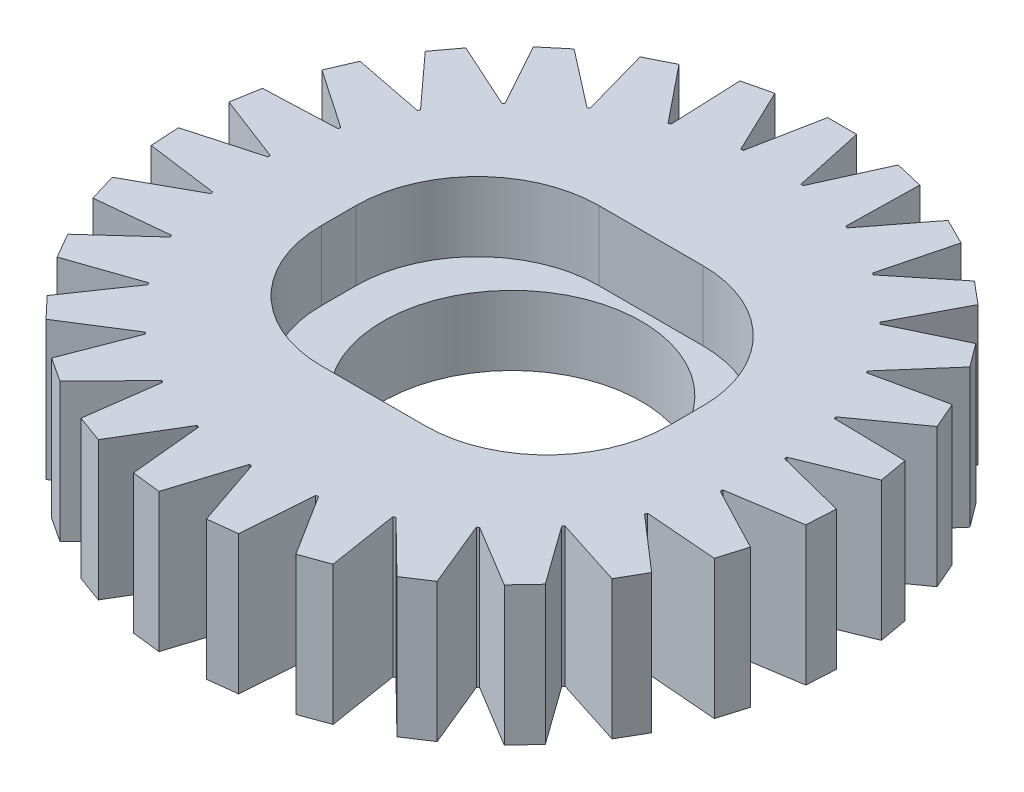
from build123d import *

# Parameters (mm, degrees)
SKETCH2_R           = 7.5
BOSS_EXTRUDE1_DEPTH = 4
SKETCH3_W           = 10
SKETCH3_H           = 8
CUT_EXTRUDE1_DEPTH  = 2
FILLET1_R           = 3.5
SKETCH4_R           = 3.725
CUT_EXTRUDE2_DEPTH  = 11.793516572
BOSS_EXTRUDE2_DEPTH = 4


with BuildPart() as part:
    # Sketch2 → Boss-Extrude1 (new body)
    with BuildSketch(Plane(origin=(0, 0, 0), x_dir=(1, 0, 0), z_dir=(0, 1, 0))):
        Circle(SKETCH2_R)
    extrude(amount=BOSS_EXTRUDE1_DEPTH)

    # Sketch3 → Cut-Extrude1 (cut)
    with BuildSketch(Plane(origin=(0, 4, 0), x_dir=(1, 0, 0), z_dir=(0, 1, 0))):
        Rectangle(SKETCH3_W, SKETCH3_H)
    extrude(amount=-CUT_EXTRUDE1_DEPTH, mode=Mode.SUBTRACT)

    # Fillet1
    fillet1_edges = [part.edges().sort_by_distance(p)[0] for p in [
        (-5, 3, 4),
        (5, 3, 4),
        (-5, 3, -4),
        (5, 3, -4),
    ]]
    fillet(fillet1_edges, radius=FILLET1_R)

    # Sketch4 → Cut-Extrude2 (cut, through all)
    with BuildSketch(Plane(origin=(0, 2, 0), x_dir=(1, 0, 0), z_dir=(0, 1, 0))):
        Circle(SKETCH4_R)
    extrude(amount=-CUT_EXTRUDE2_DEPTH, mode=Mode.SUBTRACT)

    # Sketch5 → Boss-Extrude2 (add)
    with BuildSketch(Plane(origin=(0, 4, 0), x_dir=(1, 0, 0), z_dir=(0, 1, 0))):
        Polygon((-0.798563362, 7.436706189), (-0.399724209, 9.492261827), (0.436868604, 9.492261827), (0.88172766, 7.436706189), align=None)
        Polygon((2.614158981, 9.135647848), (2.57298305, 7.03290842), (0.93798449, 7.420410197), (1.800116636, 9.328579428), align=None)
        Polygon((4.65051937, 8.286528728), (4.125528258, 6.249964737), (2.623965355, 7.00407797), (3.902912726, 8.661990897), align=None)
        Polygon((6.436169057, 6.9906807), (5.45566517, 5.130083837), (4.168487569, 6.210154086), (5.795301782, 7.528432194), align=None)
        Polygon((7.874843204, 5.317963266), (6.49168576, 3.733638789), (5.488285539, 5.081439189), (7.375264618, 5.989013763), align=None)
        Polygon((8.888982515, 3.358553055), (7.177737891, 2.135912309), (6.512208616, 3.678782589), (8.55762503, 4.126726051), align=None)
        Polygon((9.423914478, 1.21808238), (7.476836314, 0.423038242), (7.18505684, 2.077801868), (9.278641661, 2.041965468), align=None)
        Polygon((9.450800772, -0.988055431), (7.372856556, -1.312641925), (7.47055679, 0.36480631), (9.499444318, -0.152878001), align=None)
        Polygon((8.968191951, -3.140926919), (6.871404192, -2.977557227), (7.35331709, -1.36785605), (9.208129474, -2.339479778), align=None)
        Polygon((8.00210558, -5.124470223), (5.999512651, -4.481951647), (6.839658162, -3.026776936), (8.420401986, -4.399959594), align=None)
        Polygon((6.604623626, -6.831752011), (4.804185829, -5.744722895), (5.957271492, -4.522523495), (7.178728448, -6.22323645), align=None)
        Polygon((4.851084703, -8.17073228), (3.349864106, -6.697794644), (4.753726774, -5.774459641), (5.550047801, -7.711017018), align=None)
        Polygon((2.836022547, -9.069226256), (1.714950341, -7.28978655), (3.293907416, -6.715093174), (3.62216264, -8.783094663), align=None)
        Polygon((0.668069683, -9.478795898), (-0.01241684, -7.488784176), (1.656512656, -7.293714295), (1.499005754, -9.3816734), align=None)
        Polygon((-1.535898992, -9.377361199), (-1.739114626, -7.284059509), (-0.07018513, -7.47912939), (-0.704962921, -9.474483697), align=None)
        Polygon((-3.657066954, -8.770390531), (-3.372056292, -6.686649309), (-1.793099218, -7.261342685), (-2.870926861, -9.056522125), align=None)
        Polygon((-5.58108149, -7.690605839), (-4.823209531, -5.728760113), (-3.419346862, -6.652095116), (-4.882118392, -8.150321101), align=None)
        Polygon((-7.204218478, -6.196218596), (-6.014342296, -4.462031977), (-4.861256633, -5.684231377), (-6.630113656, -6.804734157), align=None)
        Polygon((-8.438974184, -4.367791605), (-6.88124031, -2.954754542), (-6.041094799, -4.409929253), (-8.020677777, -5.092302233), align=None)
        Polygon((-9.218782607, -2.303895837), (-7.377168879, -1.288185525), (-6.895255982, -2.897886702), (-8.978845083, -3.105342978), align=None)
        Polygon((-9.501604073, -0.115796449), (-7.475392364, 0.447829907), (-7.37769213, -1.229618329), (-9.452960527, -0.950973879), align=None)
        Polygon((-9.272191604, 2.078545556), (-7.170615511, 2.159702713), (-7.462394985, 0.504939087), (-9.417464422, 1.254662468), align=None)
        Polygon((-8.542912886, 4.160832632), (-6.47926892, 3.755145387), (-7.144798195, 2.212275106), (-8.874270372, 3.392659637), align=None)
        Polygon((-7.353083523, 6.018808144), (-5.438623265, 5.148147201), (-6.442023485, 3.800346801), (-7.852662109, 5.347757646), align=None)
        Polygon((-5.766847524, 7.552308151), (-4.104780021, 6.263611066), (-5.391957622, 5.183540817), (-6.407714799, 7.014556657), align=None)
        Polygon((-3.869719282, 8.678661271), (-2.549647025, 7.041402038), (-4.051209927, 6.287288805), (-4.617325926, 8.303199102), align=None)
        Polygon((-1.763973473, 9.337145515), (-0.857061897, 7.439589204), (-2.492060457, 7.052087427), (-2.578015818, 9.144213935), align=None)
    extrude(amount=-BOSS_EXTRUDE2_DEPTH)


solid = part.part
